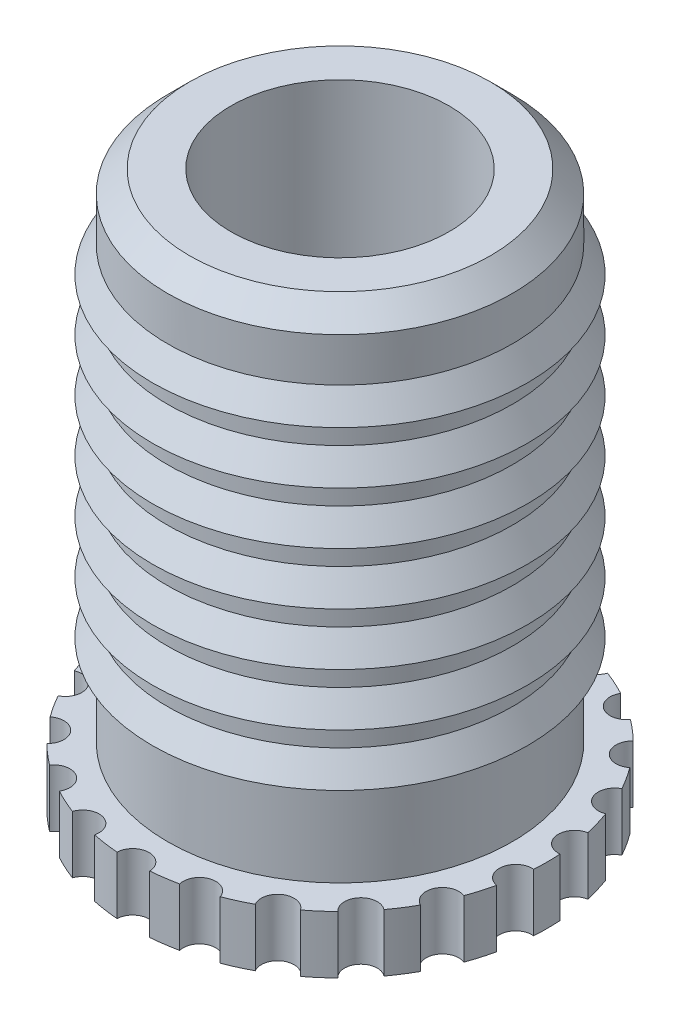
from build123d import *

# Parameters (mm, degrees)
SKETCH1_R           = 4.75
SKETCH1_R_2         = 2.5
BOSS_EXTRUDE1_DEPTH = 1.32
SKETCH2_R           = 3.95
SKETCH2_R_2         = 2.5
BOSS_EXTRUDE2_DEPTH = 11.38
LPATTERN1_COUNT     = 7
LPATTERN1_PITCH     = 1.2
CHAMFER1_SIZE       = 0.5
SKETCH4_R           = 0.375
CUT_EXTRUDE1_DEPTH  = 2
CIRPATTERN1_COUNT   = 22


with BuildPart() as part:
    # Sketch1 → Boss-Extrude1 (new body)
    with BuildSketch(Plane(origin=(0, 0, 0), x_dir=(1, 0, 0), z_dir=(0, 1, 0))):
        Circle(SKETCH1_R)
        Circle(SKETCH1_R_2, mode=Mode.SUBTRACT)
    extrude(amount=BOSS_EXTRUDE1_DEPTH)

    # Sketch2 → Boss-Extrude2 (add)
    with BuildSketch(Plane(origin=(0, 1.32, 0), x_dir=(1, 0, 0), z_dir=(0, 1, 0))):
        Circle(SKETCH2_R)
        Circle(SKETCH2_R_2, mode=Mode.SUBTRACT)
    extrude(amount=BOSS_EXTRUDE2_DEPTH)

    # Sketch3 → Revolve1 (revolve)
    with BuildSketch(Plane.XY):
        Polygon((3.45, 11.2), (3.95, 11.2), (4.296410162, 10.6), (3.45, 10.6), align=None)
    revolve1 = revolve(axis=Axis((0, 0, 0), (0, 1, 0)))

    # LPattern1: Revolve1 ×7
    with Locations(*[(0, -i * LPATTERN1_PITCH, 0) for i in range(1, LPATTERN1_COUNT)]):
        add(revolve1)

    # Chamfer1
    chamfer1_edges = [part.edges().sort_by_distance(p)[0] for p in [
        (-3.95, 12.7, 0),
    ]]
    chamfer(chamfer1_edges, length=CHAMFER1_SIZE)

    # Sketch4 → Cut-Extrude1 (cut)
    with BuildSketch(Plane.XZ):
        with Locations((0, 4.75)):
            Circle(SKETCH4_R)
    cut_extrude1 = extrude(amount=-CUT_EXTRUDE1_DEPTH, mode=Mode.SUBTRACT)

    # CirPattern1: Cut-Extrude1 ×22 about axis
    cirpattern1_axis = Axis((0, 0, 0), (0, 1, 0))
    for i in range(1, CIRPATTERN1_COUNT):
        add(cut_extrude1.rotate(cirpattern1_axis, i * 360 / CIRPATTERN1_COUNT), mode=Mode.SUBTRACT)


solid = part.part
